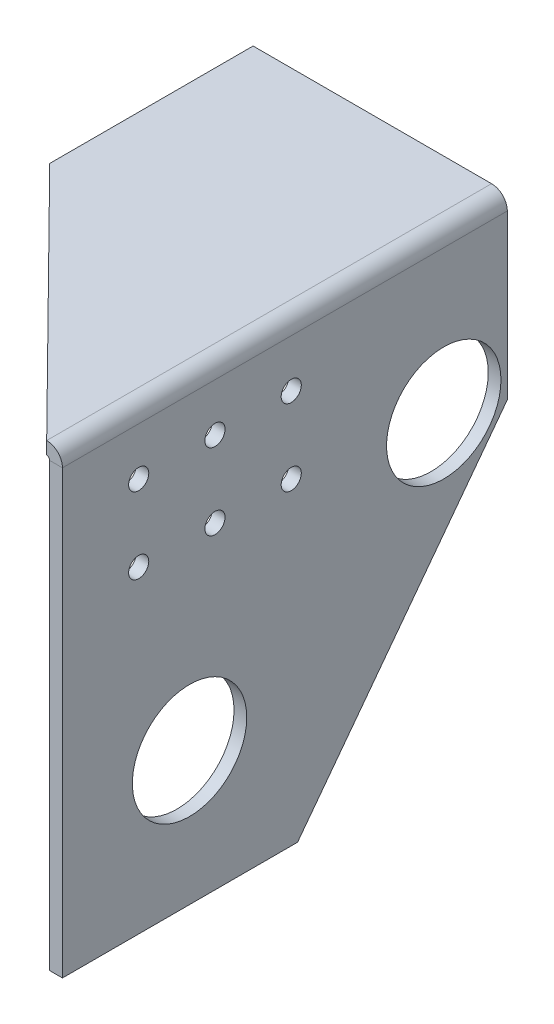
from build123d import *

# Parameters (mm, degrees)
BASE_FLANGE1_DEPTH      = 111.125
SKETCH16_R              = 14.2875
SKETCH16_R_2            = 2.5146
CUT_EXTRUDE1_DEPTH      = 172.596927784
CUT_EXTRUDE2_DEPTH      = 2.54
CUT_EXTRUDE2_DEPTH_BACK = 172.596927784


# Read off the part's stored shape, not the designer's step: Base-Flange1
with BuildPart() as part:
    # Base-Flange1 outline → Base-Flange1 (new body)
    with BuildSketch(Plane.XY):
        with BuildLine():
            Line((60.325, -3.937), (60.325, -114.3))
            Line((60.325, -114.3), (63.5, -114.3))
            Line((63.5, -114.3), (63.5, -3.937))
            ThreePointArc((63.5, -3.937), (62.346879398, -1.153120602), (59.563, 0))
            Line((59.563, 0), (0, 0))
            Line((0, 0), (0, -3.175))
            Line((0, -3.175), (59.563, -3.175))
            ThreePointArc((59.563, -3.175), (60.101815367, -3.398184633), (60.325, -3.937))
        make_face()
    extrude(amount=BASE_FLANGE1_DEPTH)

    # Sketch16 → Cut-Extrude1 (cut, through all)
    with BuildSketch(Plane(origin=(63.5, 0, 0), x_dir=(0, 0, -1), z_dir=(1, 0, 0))):
        with Locations((-79.375, -80.9625)):
            Circle(SKETCH16_R)
        with Locations((-15.875, -39.6875)):
            Circle(SKETCH16_R)
        with Locations((-53.975, -15.875)):
            Circle(SKETCH16_R_2)
        with Locations((-53.975, -34.925)):
            Circle(SKETCH16_R_2)
        with Locations((-73.025, -15.875)):
            Circle(SKETCH16_R_2)
        with Locations((-73.025, -34.925)):
            Circle(SKETCH16_R_2)
        with Locations((-92.075, -15.875)):
            Circle(SKETCH16_R_2)
        with Locations((-92.075, -34.925)):
            Circle(SKETCH16_R_2)
        Polygon((0, -44.774825848), (-52.3875, -114.3), (0, -114.3), align=None)
    extrude(amount=-CUT_EXTRUDE1_DEPTH, mode=Mode.SUBTRACT)

    # Sketch17 → Cut-Extrude2 (cut, two sides: drawn at the far end of the back side and taken through both)
    with BuildSketch(Plane(origin=(0, 0, 0), x_dir=(1, 0, 0), z_dir=(0, 1, 0)).offset(-CUT_EXTRUDE2_DEPTH_BACK)):
        Polygon((-184.195113126, 135.751553806), (0, -50.8), (59.563, -111.125), (243.758113126, -297.676553806), (-129.344994485, -666.066780058), (-557.298220737, -232.638672446), align=None)
    extrude(amount=CUT_EXTRUDE2_DEPTH + CUT_EXTRUDE2_DEPTH_BACK, mode=Mode.SUBTRACT)


solid = part.part
